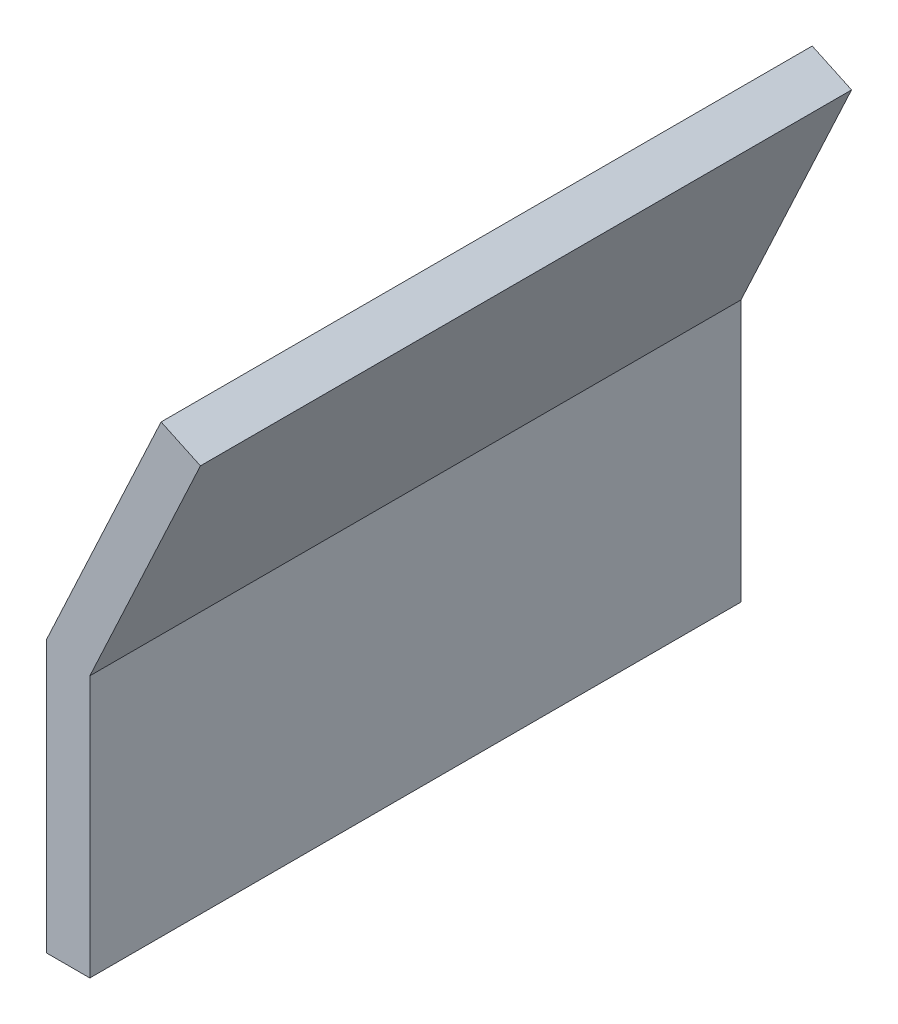
from build123d import *

# Parameters (mm, degrees)
BOSS_EXTRUDE1_DEPTH = 60


with BuildPart() as part:
    # Sketch1 → Boss-Extrude1 (new, symmetric)
    with BuildSketch(Plane.XY):
        Polygon((0, 0), (21.130913087, 45.315389352), (28.381375383, 41.934443258), (8, -1.773557301), (8, -50), (0, -50), align=None)
    extrude(amount=BOSS_EXTRUDE1_DEPTH, both=True)


solid = part.part
